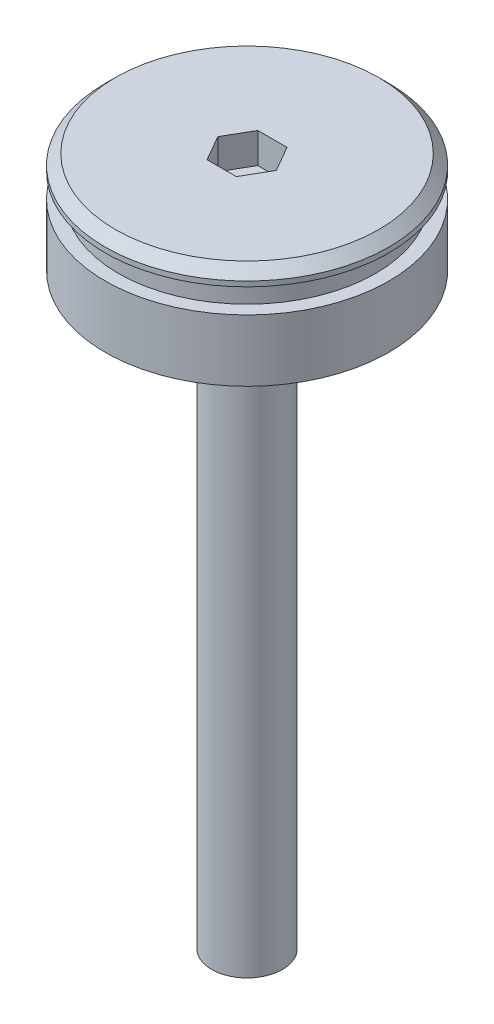
from build123d import *

# Parameters (mm, degrees)
SMUSSO1_SIZE             = 1
TAGLIO_ESTRUSIONE1_DEPTH = 3


with BuildPart() as part:
    # Schizzo1 → Rivoluzione1 (revolve)
    with BuildSketch(Plane.XY):
        Polygon((-3.5, 0), (0, 0), (0, 68), (-14, 68), (-14, 66.5), (-12.7, 66.5), (-12.7, 64.1), (-14, 64.1), (-14, 58), (-3.5, 58), align=None)
    revolve(axis=Axis((0, 0, 0), (0, 1, 0)))

    # Smusso1
    smusso1_edges = [part.edges().sort_by_distance(p)[0] for p in [
        (14, 68, 0),
    ]]
    chamfer(smusso1_edges, length=SMUSSO1_SIZE)

    # Schizzo2 → Taglio-Estrusione1 (cut)
    with BuildSketch(Plane(origin=(0, 68, 0), x_dir=(1, 0, 0), z_dir=(0, 1, 0))):
        Polygon((-1.443375673, 2.5), (-2.886751346, 0), (-1.443375673, -2.5), (1.443375673, -2.5), (2.886751346, 0), (1.443375673, 2.5), align=None)
    extrude(amount=-TAGLIO_ESTRUSIONE1_DEPTH, mode=Mode.SUBTRACT)


solid = part.part
